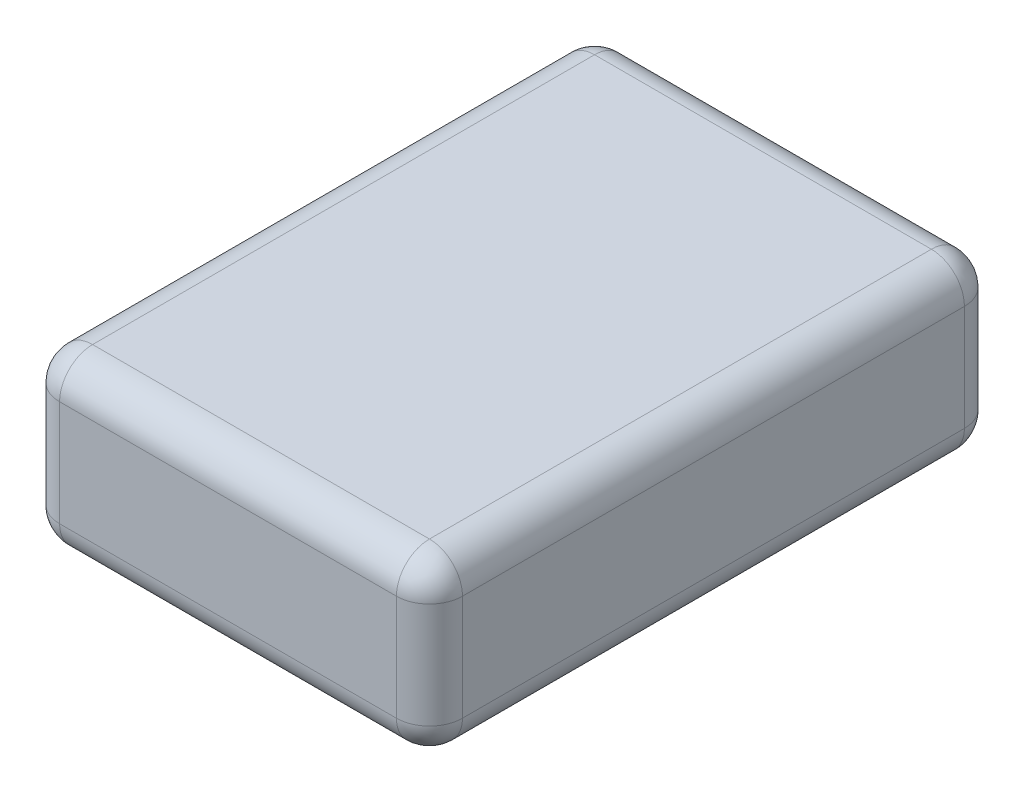
from build123d import *

# Parameters (mm, degrees)
SKETCH1_W           = 61
SKETCH1_H           = 86
BOSS_EXTRUDE1_DEPTH = 26
FILLET1_R           = 5
SKETCH2_W           = 10
SKETCH2_H           = 10
CUT_EXTRUDE1_DEPTH  = 10


with BuildPart() as part:
    # Sketch1 → Boss-Extrude1 (new body)
    with BuildSketch(Plane(origin=(0, 0, 0), x_dir=(1, 0, 0), z_dir=(0, 1, 0))):
        Rectangle(SKETCH1_W, SKETCH1_H)
    extrude(amount=BOSS_EXTRUDE1_DEPTH)

    # Fillet1
    fillet1_edges = [part.edges().sort_by_distance(p)[0] for p in [
        (0, 0, -43),
        (0, 0, 43),
        (0, 26, 43),
        (0, 26, -43),
        (30.5, 13, 43),
        (30.5, 26, 0),
        (30.5, 13, -43),
        (30.5, 0, 0),
        (-30.5, 13, -43),
        (-30.5, 26, 0),
        (-30.5, 13, 43),
        (-30.5, 0, 0),
    ]]
    fillet(fillet1_edges, radius=FILLET1_R)

    # Sketch2 → Cut-Extrude1 (cut)
    with BuildSketch(Plane(origin=(0, 0, -43), x_dir=(-1, 0, 0), z_dir=(0, 0, -1))):
        with Locations((0, 13)):
            Rectangle(SKETCH2_W, SKETCH2_H)
    extrude(amount=-CUT_EXTRUDE1_DEPTH, mode=Mode.SUBTRACT)


solid = part.part
